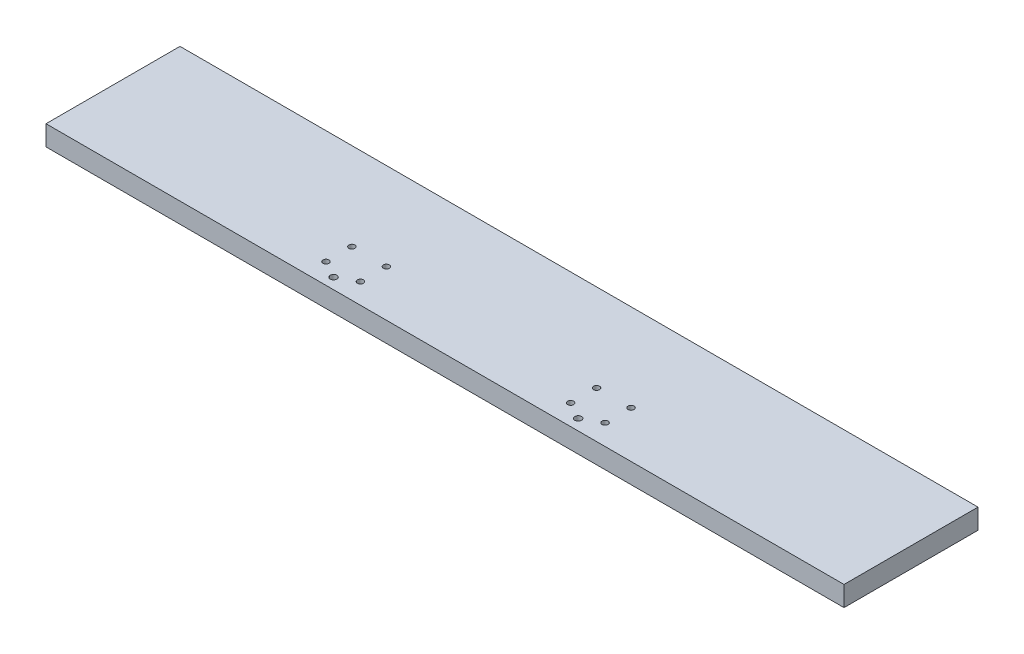
from build123d import *

# Parameters (mm, degrees)
SKETCH2_W           = 756.412
SKETCH2_H           = 127
BOSS_EXTRUDE1_DEPTH = 19.05
CUT_EXTRUDE1_REACH  = 769.236
SKETCH3_R           = 2.85115
SKETCH4_R           = 3.175
CUT_EXTRUDE2_DEPTH  = 6.35


with BuildPart() as part:
    # Sketch2 → Boss-Extrude1 (new body)
    with BuildSketch(Plane(origin=(0, 0, 0), x_dir=(1, 0, 0), z_dir=(0, 1, 0))):
        with Locations((378.206, 63.5)):
            Rectangle(SKETCH2_W, SKETCH2_H)
    extrude(amount=BOSS_EXTRUDE1_DEPTH)

    # Sketch3 → Cut-Extrude1 (cut, up to next)
    with BuildSketch(Plane(origin=(0, 19.05, 0), x_dir=(1, 0, 0), z_dir=(0, 1, 0)), mode=Mode.PRIVATE) as cut_extrude1_sk1:
        with Locations((245.92915, 19.46275)):
            Circle(SKETCH3_R)
    cut_extrude1_tool1 = extrude(cut_extrude1_sk1.sketch, amount=-CUT_EXTRUDE1_REACH, mode=Mode.PRIVATE) & part.part
    # Sketch3 → Cut-Extrude1 (cut, up to next)
    with BuildSketch(Plane(origin=(0, 19.05, 0), x_dir=(1, 0, 0), z_dir=(0, 1, 0)), mode=Mode.PRIVATE) as cut_extrude1_sk2:
        with Locations((278.58085, 19.46275)):
            Circle(SKETCH3_R)
    cut_extrude1_tool2 = extrude(cut_extrude1_sk2.sketch, amount=-CUT_EXTRUDE1_REACH, mode=Mode.PRIVATE) & part.part
    # Sketch3 → Cut-Extrude1 (cut, up to next)
    with BuildSketch(Plane(origin=(0, 19.05, 0), x_dir=(1, 0, 0), z_dir=(0, 1, 0)), mode=Mode.PRIVATE) as cut_extrude1_sk3:
        with Locations((278.58085, 44.03725)):
            Circle(SKETCH3_R)
    cut_extrude1_tool3 = extrude(cut_extrude1_sk3.sketch, amount=-CUT_EXTRUDE1_REACH, mode=Mode.PRIVATE) & part.part
    # Sketch3 → Cut-Extrude1 (cut, up to next)
    with BuildSketch(Plane(origin=(0, 19.05, 0), x_dir=(1, 0, 0), z_dir=(0, 1, 0)), mode=Mode.PRIVATE) as cut_extrude1_sk4:
        with Locations((245.92915, 44.03725)):
            Circle(SKETCH3_R)
    cut_extrude1_tool4 = extrude(cut_extrude1_sk4.sketch, amount=-CUT_EXTRUDE1_REACH, mode=Mode.PRIVATE) & part.part
    # Sketch3 → Cut-Extrude1 (cut, up to next)
    with BuildSketch(Plane(origin=(0, 19.05, 0), x_dir=(1, 0, 0), z_dir=(0, 1, 0)), mode=Mode.PRIVATE) as cut_extrude1_sk5:
        with Locations((477.83115, 19.46275)):
            Circle(SKETCH3_R)
    cut_extrude1_tool5 = extrude(cut_extrude1_sk5.sketch, amount=-CUT_EXTRUDE1_REACH, mode=Mode.PRIVATE) & part.part
    # Sketch3 → Cut-Extrude1 (cut, up to next)
    with BuildSketch(Plane(origin=(0, 19.05, 0), x_dir=(1, 0, 0), z_dir=(0, 1, 0)), mode=Mode.PRIVATE) as cut_extrude1_sk6:
        with Locations((510.48285, 19.46275)):
            Circle(SKETCH3_R)
    cut_extrude1_tool6 = extrude(cut_extrude1_sk6.sketch, amount=-CUT_EXTRUDE1_REACH, mode=Mode.PRIVATE) & part.part
    # Sketch3 → Cut-Extrude1 (cut, up to next)
    with BuildSketch(Plane(origin=(0, 19.05, 0), x_dir=(1, 0, 0), z_dir=(0, 1, 0)), mode=Mode.PRIVATE) as cut_extrude1_sk7:
        with Locations((510.48285, 44.03725)):
            Circle(SKETCH3_R)
    cut_extrude1_tool7 = extrude(cut_extrude1_sk7.sketch, amount=-CUT_EXTRUDE1_REACH, mode=Mode.PRIVATE) & part.part
    # Sketch3 → Cut-Extrude1 (cut, up to next)
    with BuildSketch(Plane(origin=(0, 19.05, 0), x_dir=(1, 0, 0), z_dir=(0, 1, 0)), mode=Mode.PRIVATE) as cut_extrude1_sk8:
        with Locations((477.83115, 44.03725)):
            Circle(SKETCH3_R)
    cut_extrude1_tool8 = extrude(cut_extrude1_sk8.sketch, amount=-CUT_EXTRUDE1_REACH, mode=Mode.PRIVATE) & part.part
    add(cut_extrude1_tool1.solids().sort_by_distance((245.92915, 19.05, -19.46275))[0], mode=Mode.SUBTRACT)
    add(cut_extrude1_tool2.solids().sort_by_distance((278.58085, 19.05, -19.46275))[0], mode=Mode.SUBTRACT)
    add(cut_extrude1_tool3.solids().sort_by_distance((278.58085, 19.05, -44.03725))[0], mode=Mode.SUBTRACT)
    add(cut_extrude1_tool4.solids().sort_by_distance((245.92915, 19.05, -44.03725))[0], mode=Mode.SUBTRACT)
    add(cut_extrude1_tool5.solids().sort_by_distance((477.83115, 19.05, -19.46275))[0], mode=Mode.SUBTRACT)
    add(cut_extrude1_tool6.solids().sort_by_distance((510.48285, 19.05, -19.46275))[0], mode=Mode.SUBTRACT)
    add(cut_extrude1_tool7.solids().sort_by_distance((510.48285, 19.05, -44.03725))[0], mode=Mode.SUBTRACT)
    add(cut_extrude1_tool8.solids().sort_by_distance((477.83115, 19.05, -44.03725))[0], mode=Mode.SUBTRACT)

    # Sketch4 → Cut-Extrude2 (cut)
    with BuildSketch(Plane(origin=(0, 19.05, 0), x_dir=(1, 0, 0), z_dir=(0, 1, 0))):
        with Locations((494.157, 10.31875)):
            Circle(SKETCH4_R)
        with Locations((262.255, 10.31875)):
            Circle(SKETCH4_R)
    extrude(amount=-CUT_EXTRUDE2_DEPTH, mode=Mode.SUBTRACT)


solid = part.part
